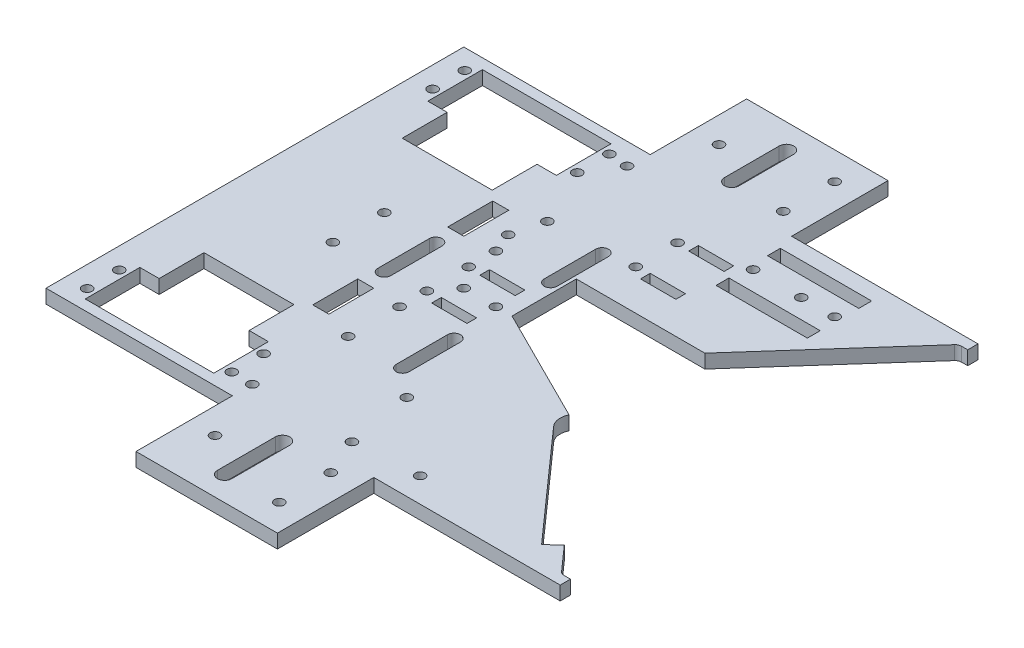
from build123d import *

# Parameters (mm, degrees)
BOSS_EXTRUDE1_DEPTH = 4.3
CUT_EXTRUDE1_DEPTH  = 4.5
FILLET1_R           = 2
CUT_EXTRUDE2_DEPTH  = 10
SKETCH8_R           = 1.5
CUT_EXTRUDE3_DEPTH  = 10
SKETCH9_R           = 1.5
CUT_EXTRUDE4_DEPTH  = 10
CUT_EXTRUDE5_DEPTH  = 10
SKETCH11_R          = 1.5
CUT_EXTRUDE6_DEPTH  = 10
SKETCH12_R          = 1.5
CUT_EXTRUDE7_DEPTH  = 10
SKETCH7_R           = 1.5
SKETCH7_W           = 11
SKETCH7_H           = 3
CUT_EXTRUDE8_DEPTH  = 9
SKETCH13_R          = 1.5
CUT_EXTRUDE9_DEPTH  = 10
SKETCH14_R          = 1.5
CUT_EXTRUDE10_DEPTH = 10
SKETCH15_W          = 5
SKETCH15_H          = 14
CUT_EXTRUDE11_DEPTH = 10
SKETCH16_R          = 1.5
CUT_EXTRUDE12_DEPTH = 10
SKETCH18_R          = 1.5
SKETCH18_W          = 28.4
SKETCH18_H          = 4
CUT_EXTRUDE13_DEPTH = 10


with BuildPart() as part:
    # Sketch2 → Boss-Extrude1 (new body)
    with BuildSketch(Plane(origin=(0, 0, 0), x_dir=(1, 0, 0), z_dir=(0, 1, 0))):
        Polygon((0, 0), (0, 65), (58, 65), (58, 95), (102, 95), (102, 65), (160, 65), (160, 0), align=None)
    extrude(amount=BOSS_EXTRUDE1_DEPTH)

    # Mirror1: part across plane


with BuildPart() as part_1:
    add(part.part)
    add(part.part.mirror(Plane(origin=(0, 4.3, 0), x_dir=(1, 0, 0), z_dir=(0, 0, -1))))

    # Sketch3 → Cut-Extrude1 (cut)
    with BuildSketch(Plane(origin=(0, 4.3, 0), x_dir=(1, 0, 0), z_dir=(0, 1, 0))):
        Polygon((160, -61.8), (160, 61.8), (157.156451185, 61.8), (120.012594795, 20), (80.012594795, 20), (80.012594795, 0), (120, -20), (157.155555556, -61.8), align=None)
    extrude(amount=-CUT_EXTRUDE1_DEPTH, mode=Mode.SUBTRACT)

    # Fillet1
    fillet1_edges = [part_1.edges().sort_by_distance(p)[0] for p in [
        (157.156451185, 2.15, -61.8),
        (157.155555556, 2.15, 61.8),
    ]]
    fillet(fillet1_edges, radius=FILLET1_R)

    # Sketch6 → Cut-Extrude2 (cut)
    with BuildSketch(Plane(origin=(0, 4.3, 0), x_dir=(1, 0, 0), z_dir=(0, 1, 0))):
        Polygon((9, -61.8), (49, -61.8), (49, -44.8), (43, -44.8), (43, -30.841820122), (15, -30.841820122), (15, -44.8), (9, -44.8), align=None)
        Polygon((9, 44.8), (15, 44.8), (15, 30.841820122), (43, 30.841820122), (43, 44.8), (49, 44.8), (49, 61.8), (9, 61.8), align=None)
    extrude(amount=-CUT_EXTRUDE2_DEPTH, mode=Mode.SUBTRACT)

    # Sketch8 → Cut-Extrude3 (cut)
    with BuildSketch(Plane(origin=(0, 4.3, 0), x_dir=(1, 0, 0), z_dir=(0, 1, 0))):
        with Locations((6.5, 58.8)):
            Circle(SKETCH8_R)
        with Locations((6.5, 48.8)):
            Circle(SKETCH8_R)
        with Locations((51.5, 48.8)):
            Circle(SKETCH8_R)
        with Locations((51.5, 58.8)):
            Circle(SKETCH8_R)
        with Locations((6.5, -48.7)):
            Circle(SKETCH8_R)
        with Locations((6.5, -58.7)):
            Circle(SKETCH8_R)
        with Locations((51.5, -58.7)):
            Circle(SKETCH8_R)
        with Locations((51.5, -48.8)):
            Circle(SKETCH8_R)
    extrude(amount=-CUT_EXTRUDE3_DEPTH, mode=Mode.SUBTRACT)

    # Sketch9 → Cut-Extrude4 (cut)
    with BuildSketch(Plane.XZ):
        with Locations((94, 70.4)):
            Circle(SKETCH9_R)
        with Locations((66, 78.4)):
            Circle(SKETCH9_R)
        with Locations((66, -78.4)):
            Circle(SKETCH9_R)
        with Locations((94, -86.4)):
            Circle(SKETCH9_R)
        with Locations((94, 86.4)):
            Circle(SKETCH9_R)
        with Locations((94, -70.4)):
            Circle(SKETCH9_R)
        with BuildLine():
            Line((75.75, 69.4), (75.75, 87.4))
            ThreePointArc((75.75, 87.4), (78, 89.65), (80.25, 87.4))
            Line((80.25, 87.4), (80.25, 69.4))
            ThreePointArc((80.25, 69.4), (78, 67.15), (75.75, 69.4))
        make_face()
        with BuildLine():
            Line((75.75, -87.4), (75.75, -70.4))
            ThreePointArc((75.75, -70.4), (78, -68.15), (80.25, -70.4))
            Line((80.25, -70.4), (80.25, -87.4))
            ThreePointArc((80.25, -87.4), (78, -89.65), (75.75, -87.4))
        make_face()
    extrude(amount=-CUT_EXTRUDE4_DEPTH, mode=Mode.SUBTRACT)

    # Sketch10 → Cut-Extrude5 (cut)
    with BuildSketch(Plane(origin=(0, 4.3, 0), x_dir=(1, 0, 0), z_dir=(0, 1, 0))):
        with BuildLine():
            Line((123.321819194, -23.737046593), (149.896372747, -53.633419341))
            Line((149.896372747, -53.633419341), (146.159326154, -56.955238535))
            Line((146.159326154, -56.955238535), (116.262953407, -23.321819194))
            ThreePointArc((116.262953407, -23.321819194), (120.29361011, -15.008628134), (123.321819194, -23.737046593))
        make_face()
    extrude(amount=-CUT_EXTRUDE5_DEPTH, mode=Mode.SUBTRACT)

    # Sketch11 → Cut-Extrude6 (cut)
    with BuildSketch(Plane.XZ):
        with BuildLine():
            ThreePointArc((79, 31.031280577), (77, 33.031280577), (75, 31.031280577))
            Line((75, 31.031280577), (75, 15.031280577))
            ThreePointArc((75, 15.031280577), (77, 13.031280577), (79, 15.031280577))
            Line((79, 15.031280577), (79, 31.031280577))
        make_face()
        with BuildLine():
            ThreePointArc((75, -31.031280577), (77, -33.031280577), (79, -31.031280577))
            Line((79, -31.031280577), (79, -15.031280577))
            ThreePointArc((79, -15.031280577), (77, -13.031280577), (75, -15.031280577))
            Line((75, -15.031280577), (75, -31.031280577))
        make_face()
        with Locations((60, 31)):
            Circle(SKETCH11_R)
        with Locations((60, 15)):
            Circle(SKETCH11_R)
        with Locations((60, -15)):
            Circle(SKETCH11_R)
        with Locations((60, -31)):
            Circle(SKETCH11_R)
    extrude(amount=-CUT_EXTRUDE6_DEPTH, mode=Mode.SUBTRACT)

    # Sketch12 → Cut-Extrude7 (cut)
    with BuildSketch(Plane(origin=(0, 0, 0), x_dir=(-1, 0, 0), z_dir=(0, -1, 0))):
        with BuildLine():
            ThreePointArc((-50.262723036, -8), (-48.262723036, -10), (-46.262723036, -8))
            Line((-46.262723036, -8), (-46.262723036, 8))
            ThreePointArc((-46.262723036, 8), (-48.262723036, 10), (-50.262723036, 8))
            Line((-50.262723036, 8), (-50.262723036, -8))
        make_face()
        with Locations((-32.262723036, -8)):
            Circle(SKETCH12_R)
        with Locations((-32.262723036, 8)):
            Circle(SKETCH12_R)
    extrude(amount=-CUT_EXTRUDE7_DEPTH, mode=Mode.SUBTRACT)

    # Sketch7 → Cut-Extrude8 (cut)
    with BuildSketch(Plane(origin=(0, 4.3, 0), x_dir=(1, 0, 0), z_dir=(0, 1, 0))):
        with Locations((60.012594795, -6.5)):
            Circle(SKETCH7_R)
        with Locations((60.012594795, 6.5)):
            Circle(SKETCH7_R)
        with Locations((86, 32.5)):
            Circle(SKETCH7_R)
        with Locations((86, 45.5)):
            Circle(SKETCH7_R)
        with Locations((69.5, -7.5)):
            Rectangle(SKETCH7_W, SKETCH7_H)
        with Locations((69.5, 7.5)):
            Rectangle(SKETCH7_W, SKETCH7_H)
        with Locations((95.487405205, 31.5)):
            Rectangle(SKETCH7_W, SKETCH7_H)
        with Locations((95.487405205, 46.5)):
            Rectangle(SKETCH7_W, SKETCH7_H)
    extrude(amount=-CUT_EXTRUDE8_DEPTH, mode=Mode.SUBTRACT)

    # Sketch13 → Cut-Extrude9 (cut)
    with BuildSketch(Plane(origin=(0, 4.3, 0), x_dir=(1, 0, 0), z_dir=(0, 1, 0))):
        with Locations((75, 0)):
            Circle(SKETCH13_R)
        with Locations((65, 0)):
            Circle(SKETCH13_R)
    extrude(amount=-CUT_EXTRUDE9_DEPTH, mode=Mode.SUBTRACT)

    # Sketch14 → Cut-Extrude10 (cut)
    with BuildSketch(Plane(origin=(0, 4.3, 0), x_dir=(1, 0, 0), z_dir=(0, 1, 0))):
        with Locations((57.5, 58.3)):
            Circle(SKETCH14_R)
        with Locations((57.5, 21.3)):
            Circle(SKETCH14_R)
        with Locations((85.565271793, -38.309819587)):
            Circle(SKETCH14_R)
        with Locations((108.754116531, -57.343407785)):
            Circle(SKETCH14_R)
    extrude(amount=-CUT_EXTRUDE10_DEPTH, mode=Mode.SUBTRACT)

    # Sketch15 → Cut-Extrude11 (cut)
    with BuildSketch(Plane(origin=(0, 4.3, 0), x_dir=(1, 0, 0), z_dir=(0, 1, 0))):
        with Locations((48.5, 21)):
            Rectangle(SKETCH15_W, SKETCH15_H)
        with Locations((48.5, -21)):
            Rectangle(SKETCH15_W, SKETCH15_H)
    extrude(amount=-CUT_EXTRUDE11_DEPTH, mode=Mode.SUBTRACT)

    # Sketch16 → Cut-Extrude12 (cut)
    with BuildSketch(Plane(origin=(0, 4.3, 0), x_dir=(1, 0, 0), z_dir=(0, 1, 0))):
        with Locations((89, -58.8)):
            Circle(SKETCH16_R)
        with Locations((58, -58.8)):
            Circle(SKETCH16_R)
    extrude(amount=-CUT_EXTRUDE12_DEPTH, mode=Mode.SUBTRACT)

    # Sketch18 → Cut-Extrude13 (cut)
    with BuildSketch(Plane(origin=(0, 4.3, 0), x_dir=(1, 0, 0), z_dir=(0, 1, 0))):
        with Locations((130.4, 50)):
            Circle(SKETCH18_R)
        with Locations((120, 50)):
            Circle(SKETCH18_R)
        with Locations((105, 50)):
            Circle(SKETCH18_R)
        with Locations((117.7, 58)):
            Rectangle(SKETCH18_W, SKETCH18_H)
        with Locations((117.7, 42)):
            Rectangle(SKETCH18_W, SKETCH18_H)
    extrude(amount=-CUT_EXTRUDE13_DEPTH, mode=Mode.SUBTRACT)


solid = part_1.part
